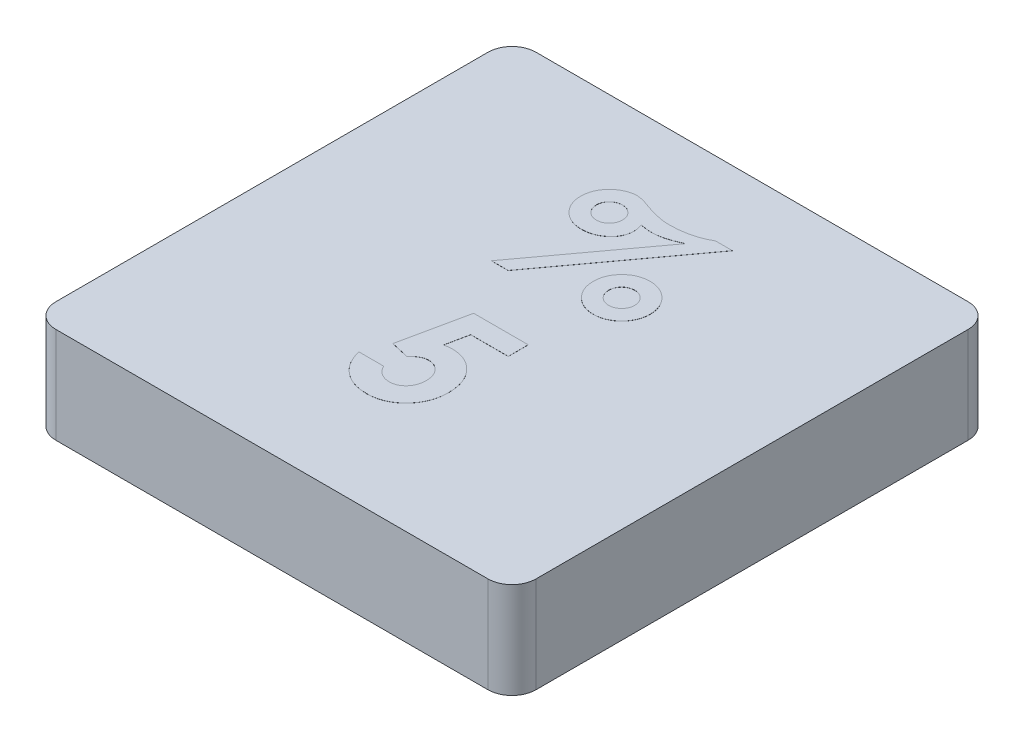
from build123d import *

# Parameters (mm, degrees)
SKETCH1_W           = 12.7
SKETCH1_H           = 12.7
BOSS_EXTRUDE1_DEPTH = 2.54
FILLET1_R           = 0.635
SHELL1_START        = 0.635
SHELL1_OUTLINE_W    = 1.905
SHELL1_OUTLINE_H    = 11.43
SHELL1_DEPTH        = 11.43
SKETCH2_R           = 2.54
BOSS_EXTRUDE2_DEPTH = 1.905
BOSS_EXTRUDE4_DEPTH = 0.00254


# Read off the part's stored shape, not the designer's step: Shell1
with BuildPart() as part:
    # Sketch1 → Boss-Extrude1 (new body)
    with BuildSketch(Plane(origin=(0, 0, 0), x_dir=(1, 0, 0), z_dir=(0, 1, 0))):
        with Locations((6.35, 6.35)):
            Rectangle(SKETCH1_W, SKETCH1_H)
    extrude(amount=BOSS_EXTRUDE1_DEPTH)

    # Fillet1
    fillet1_edges = [part.edges().sort_by_distance(p)[0] for p in [
        (0, 1.27, -12.7),
        (12.7, 1.27, -12.7),
        (12.7, 1.27, 0),
        (0, 1.27, 0),
    ]]
    fillet(fillet1_edges, radius=FILLET1_R)

    # Shell1 outline → Shell1 (cut)
    with BuildSketch(Plane.YZ.offset(SHELL1_START)):
        with Locations((0.9525, -6.35)):
            Rectangle(SHELL1_OUTLINE_W, SHELL1_OUTLINE_H)
    extrude(amount=SHELL1_DEPTH, mode=Mode.SUBTRACT)

    # Sketch2 → Boss-Extrude2 (add)
    with BuildSketch(Plane(origin=(0, 1.905, 0), x_dir=(-1, 0, 0), z_dir=(0, -1, 0))):
        with Locations(Location((-6.35, 6.35, 0), (0, 0, 270))):
            Circle(SKETCH2_R)
    extrude(amount=BOSS_EXTRUDE2_DEPTH)

    # Sketch4 → Boss-Extrude4 (add)
    # profile 1 of 3: a face of its own
    with BuildSketch(Plane(origin=(0, 2.54, 0), x_dir=(1, 0, 0), z_dir=(0, 1, 0))):
        with BuildLine():
            Line((5.791703726, 5.8928), (7.237371795, 5.8928))
            Line((7.237371795, 5.8928), (7.237371795, 5.363633333))
            Line((7.237371795, 5.363633333), (6.243276242, 5.363633333))
            Line((6.243276242, 5.363633333), (6.119252804, 4.763232692))
            add(Edge.make_bspline(
                [(6.119252804, 4.763232692), (6.136152773, 4.767939547), (6.169482984, 4.777222431), (6.219694987, 4.78653199), (6.268357416, 4.79256615), (6.300289405, 4.793371026), (6.315782252, 4.793761538)],
                knots=[0, 0, 0, 0, 1.05461699, 2.079921384, 3.068411212, 4, 4, 4, 4], degree=3))
            add(Edge.make_bspline(
                [(6.315782252, 4.793761538), (6.349542787, 4.792987935), (6.416092238, 4.791462993), (6.513445641, 4.776986318), (6.606667276, 4.754185994), (6.695471873, 4.721668028), (6.779772683, 4.679345055), (6.859671896, 4.628146122), (6.935267573, 4.567981304), (7.005216817, 4.498812934), (7.069489105, 4.422864498), (7.125370193, 4.340718228), (7.17309613, 4.25354545), (7.21105569, 4.1608043), (7.241016611, 4.063077254), (7.262667041, 3.960301687), (7.275470022, 3.852355795), (7.277196426, 3.77871203), (7.278076923, 3.741152364)],
                knots=[0, 0, 0, 0, 1.01440847, 1.999622559, 2.951875003, 3.895578053, 4.836219714, 5.782137149, 6.743708247, 7.735272588, 8.734977101, 9.730283169, 10.717124674, 11.717316708, 12.737475749, 13.78628267, 14.87096371, 16, 16, 16, 16], degree=3))
            add(Edge.make_bspline(
                [(7.278076923, 3.741152364), (7.277000941, 3.703166309), (7.274877714, 3.628208718), (7.261025605, 3.517994546), (7.236576383, 3.41243425), (7.202992931, 3.311245249), (7.158748882, 3.215171256), (7.105539358, 3.123217017), (7.042464729, 3.03606508), (6.970143973, 2.954608856), (6.891521825, 2.880156304), (6.807807797, 2.814660252), (6.719590005, 2.759545854), (6.626866321, 2.715004103), (6.530168729, 2.679763462), (6.429467881, 2.654109958), (6.324274384, 2.639399099), (6.252861667, 2.637403885), (6.216563502, 2.636389744)],
                knots=[0, 0, 0, 0, 1.06808661, 2.107647099, 3.116961351, 4.110378221, 5.100014249, 6.085620622, 7.093190682, 8.119403071, 9.144090782, 10.133780668, 11.103064255, 12.062861538, 13.020824475, 13.992378307, 14.979551724, 16, 16, 16, 16], degree=3))
            add(Edge.make_bspline(
                [(6.216563502, 2.636389744), (6.184103133, 2.637219374), (6.120084493, 2.63885558), (6.025787847, 2.648912563), (5.934875408, 2.666693402), (5.847829824, 2.692426881), (5.763735227, 2.724098918), (5.683563777, 2.763710786), (5.606874917, 2.810508222), (5.533886414, 2.863637171), (5.465784228, 2.923484872), (5.403627769, 2.988998491), (5.347040734, 3.059352263), (5.297233997, 3.135414138), (5.254363686, 3.217071739), (5.21634542, 3.303362714), (5.185227088, 3.395188215), (5.169435431, 3.458846753), (5.161410256, 3.491197436)],
                knots=[0, 0, 0, 0, 1.054957082, 2.080596141, 3.077793124, 4.061112343, 5.027190972, 5.994718051, 6.962465889, 7.943658696, 8.924948258, 9.904494768, 10.875059, 11.855380583, 12.854004648, 13.869083016, 14.917087635, 16, 16, 16, 16], degree=3))
            Line((5.161410256, 3.491197436), (5.812692308, 3.491197436))
            add(Edge.make_bspline(
                [(5.812692308, 3.491197436), (5.824597759, 3.46877973), (5.847734646, 3.425213478), (5.891746119, 3.367372731), (5.941014169, 3.318048628), (5.995094372, 3.27675926), (6.054337133, 3.245825968), (6.116328422, 3.222367591), (6.181847008, 3.208811863), (6.226468059, 3.207117263), (6.249000401, 3.206261538)],
                knots=[0, 0, 0, 0, 1.104910296, 2.147267069, 3.153527244, 4.136738762, 5.099945312, 6.05603338, 7.018353, 8, 8, 8, 8], degree=3))
            add(Edge.make_bspline(
                [(6.249000401, 3.206261538), (6.264705141, 3.206852424), (6.295604481, 3.208015), (6.341129773, 3.21416532), (6.384585664, 3.225813887), (6.426295239, 3.241944445), (6.46637054, 3.262061072), (6.504237073, 3.287457003), (6.540553649, 3.316688661), (6.574767381, 3.350232088), (6.605755161, 3.387625207), (6.632928054, 3.427806662), (6.657224368, 3.469883613), (6.675221019, 3.515522833), (6.689958754, 3.563361519), (6.700812218, 3.613760534), (6.707298387, 3.666778738), (6.707898833, 3.70297278), (6.708205128, 3.721435817)],
                knots=[0, 0, 0, 0, 0.978869489, 1.925942215, 2.855067702, 3.774946051, 4.70828698, 5.642468714, 6.60995405, 7.609372294, 8.622401667, 9.629904756, 10.629323, 11.642352373, 12.678539694, 13.745912462, 14.850161547, 16, 16, 16, 16], degree=3))
            add(Edge.make_bspline(
                [(6.708205128, 3.721435817), (6.707849637, 3.739470285), (6.707157666, 3.774574815), (6.701433541, 3.826120838), (6.691193193, 3.875028686), (6.677240629, 3.921672956), (6.659379682, 3.965770401), (6.637552412, 4.00758351), (6.611665568, 4.046900934), (6.581580172, 4.082922208), (6.549497414, 4.115961945), (6.515030223, 4.144858236), (6.478489131, 4.168840151), (6.441009605, 4.18977706), (6.4010956, 4.205014487), (6.359644619, 4.21550794), (6.316700255, 4.223207614), (6.287408836, 4.223659998), (6.272533053, 4.223889744)],
                knots=[0, 0, 0, 0, 1.166249705, 2.270133367, 3.348514167, 4.393962215, 5.415026464, 6.420877785, 7.440098956, 8.453121383, 9.451844239, 10.415694839, 11.355045125, 12.27538808, 13.187007209, 14.108269027, 15.039275622, 16, 16, 16, 16], degree=3))
            add(Edge.make_bspline(
                [(6.272533053, 4.223889744), (6.256374495, 4.223276616), (6.223989278, 4.222047777), (6.175872951, 4.212049042), (6.128336774, 4.195867337), (6.081116395, 4.173542112), (6.03468056, 4.144325435), (5.987803803, 4.110057624), (5.942055191, 4.068248796), (5.912966951, 4.037109485), (5.89791867, 4.02100012)],
                knots=[0, 0, 0, 0, 0.88288272, 1.769486374, 2.674910571, 3.623812639, 4.617874466, 5.670434592, 6.794841017, 8, 8, 8, 8], degree=3))
            Line((5.89791867, 4.02100012), (5.418361378, 4.13103117))
            Line((5.418361378, 4.13103117), (5.791703726, 5.8928))
        make_face()
    # profile 2 of 3: a face of its own
    with BuildSketch(Plane(origin=(0, 2.54, 0), x_dir=(1, 0, 0), z_dir=(0, 1, 0))):
        with BuildLine():
            Line((7.334428085, 10.749410256), (7.782184495, 10.749410256))
            Line((7.782184495, 10.749410256), (5.269278846, 7.330179487))
            Line((5.269278846, 7.330179487), (4.824702524, 7.330179487))
            Line((4.824702524, 7.330179487), (7.003698918, 10.294021635))
            add(Edge.make_bspline(
                [(7.003698918, 10.294021635), (6.971161062, 10.278515475), (6.907660287, 10.248253706), (6.812751511, 10.207957695), (6.720631579, 10.174162457), (6.631393144, 10.146830824), (6.54571733, 10.124937871), (6.463103714, 10.109434187), (6.383789665, 10.100280365), (6.331873811, 10.098832433), (6.306623598, 10.098128205)],
                knots=[0, 0, 0, 0, 1.184746767, 2.312147913, 3.388055768, 4.408713513, 5.378921178, 6.293361464, 7.169945538, 8, 8, 8, 8], degree=3))
            add(Edge.make_bspline(
                [(6.306623598, 10.098128205), (6.280737611, 10.098372121), (6.228234645, 10.09886684), (6.148559388, 10.107001685), (6.066431878, 10.116206097), (6.011451424, 10.12699396), (5.983526643, 10.132473157)],
                knots=[0, 0, 0, 0, 0.954023388, 1.934987345, 2.951172226, 4, 4, 4, 4], degree=3))
            add(Edge.make_bspline(
                [(5.983526643, 10.132473157), (5.99109623, 10.111386352), (6.005688067, 10.070737478), (6.021027763, 10.009865212), (6.030332826, 9.951920468), (6.0317938, 9.914137817), (6.0325, 9.895874599)],
                knots=[0, 0, 0, 0, 1.106503302, 2.132997967, 3.097536435, 4, 4, 4, 4], degree=3))
            add(Edge.make_bspline(
                [(6.0325, 9.895874599), (6.031956025, 9.873573311), (6.030882872, 9.829577387), (6.020337876, 9.764925729), (6.003236685, 9.702776771), (5.978685451, 9.643442241), (5.948286499, 9.586401194), (5.910007257, 9.532570281), (5.865391699, 9.481153099), (5.814897755, 9.432392522), (5.759252659, 9.388522857), (5.70057033, 9.348934639), (5.63809611, 9.317049236), (5.573190212, 9.289737291), (5.50523594, 9.268823251), (5.434072532, 9.254352123), (5.360043175, 9.245192774), (5.309587108, 9.243952007), (5.283907252, 9.243320513)],
                knots=[0, 0, 0, 0, 0.968638251, 1.910927052, 2.838731862, 3.764475236, 4.696252554, 5.642138921, 6.628626751, 7.651788751, 8.687938962, 9.705108259, 10.723111985, 11.731056968, 12.762854794, 13.807411544, 14.884071636, 16, 16, 16, 16], degree=3))
            add(Edge.make_bspline(
                [(5.283907252, 9.243320513), (5.258008022, 9.243862785), (5.207060861, 9.244929505), (5.132269572, 9.255401399), (5.060451245, 9.272576486), (4.991704378, 9.296883819), (4.925590685, 9.327610203), (4.862416389, 9.365209956), (4.802618612, 9.410084763), (4.746236132, 9.460574683), (4.695139831, 9.516337064), (4.649695061, 9.57519437), (4.611968557, 9.637691665), (4.580493072, 9.702717457), (4.55628548, 9.771004191), (4.539399603, 9.842031204), (4.527790963, 9.915634919), (4.526875468, 9.965790495), (4.526410256, 9.991277244)],
                knots=[0, 0, 0, 0, 1.048605301, 2.062743289, 3.052144275, 4.035376283, 5.011267406, 6.001003776, 7.007513402, 8.035232587, 9.062377508, 10.067200388, 11.042222018, 12.014023559, 12.989158645, 13.970212949, 14.968555884, 16, 16, 16, 16], degree=3))
            add(Edge.make_bspline(
                [(4.526410256, 9.991277244), (4.52765132, 10.024227354), (4.530113116, 10.089587755), (4.549275376, 10.185577129), (4.579731474, 10.278142828), (4.623416785, 10.365689911), (4.677314307, 10.448164002), (4.74227953, 10.522510378), (4.81742886, 10.588459061), (4.901004219, 10.64460362), (4.989322093, 10.690719992), (5.079082843, 10.723922823), (5.168151383, 10.745934816), (5.227815974, 10.748263583), (5.257194511, 10.749410256)],
                knots=[0, 0, 0, 0, 1.019835865, 2.022963857, 3.019602811, 4.029733115, 5.044079856, 6.06323913, 7.077458357, 8.131878931, 9.174395684, 10.1549869, 11.091525037, 12, 12, 12, 12], degree=3))
            add(Edge.make_bspline(
                [(5.257194511, 10.749410256), (5.281427691, 10.748048294), (5.334794778, 10.745048936), (5.420566757, 10.727143649), (5.518777759, 10.698758058), (5.587434921, 10.673750526), (5.624176683, 10.660367788)],
                knots=[0, 0, 0, 0, 0.766991245, 1.689092761, 2.763321979, 4, 4, 4, 4], degree=3))
            add(Edge.make_bspline(
                [(5.624176683, 10.660367788), (5.658027445, 10.64808356), (5.72433688, 10.624020282), (5.823071172, 10.592006574), (5.91879366, 10.565360439), (6.011543909, 10.543637127), (6.1010266, 10.52624847), (6.18763626, 10.514107891), (6.271095481, 10.506897059), (6.325691168, 10.505743955), (6.352416867, 10.505179487)],
                knots=[0, 0, 0, 0, 1.154668847, 2.261852749, 3.327345382, 4.339816463, 5.315774316, 6.249304505, 7.142998968, 8, 8, 8, 8], degree=3))
            add(Edge.make_bspline(
                [(6.352416867, 10.505179487), (6.399295126, 10.505877372), (6.491287751, 10.507246882), (6.626785638, 10.519071014), (6.757044939, 10.537823766), (6.882395572, 10.564676874), (7.002906485, 10.599023648), (7.118610995, 10.640866283), (7.229516084, 10.690443736), (7.299515532, 10.729787413), (7.334428085, 10.749410256)],
                knots=[0, 0, 0, 0, 1.098379891, 2.155430926, 3.184762878, 4.180638884, 5.157205786, 6.119039716, 7.061862248, 8, 8, 8, 8], degree=3))
        make_face()
        with BuildLine():
            add(Edge.make_bspline(
                [(5.279455128, 10.342358974), (5.256422971, 10.341177748), (5.211017096, 10.338849064), (5.14572988, 10.319073448), (5.085890771, 10.286460972), (5.033228397, 10.241971378), (4.988797404, 10.189567563), (4.956872514, 10.129944654), (4.936932914, 10.065470351), (4.934629763, 10.020465291), (4.933461538, 9.99763742)],
                knots=[0, 0, 0, 0, 1.017893676, 2.006687987, 2.989361888, 4.015528455, 5.041695023, 6.011649149, 6.991450778, 8, 8, 8, 8], degree=3))
            add(Edge.make_bspline(
                [(4.933461538, 9.99763742), (4.93457434, 9.974370673), (4.936748554, 9.928911622), (4.957196791, 9.863808766), (4.988372228, 9.80335595), (5.033277943, 9.750785169), (5.085878128, 9.706263219), (5.14573321, 9.673659054), (5.211016233, 9.653881256), (5.256422681, 9.65155287), (5.279455128, 9.650371795)],
                knots=[0, 0, 0, 0, 1.022731703, 1.998234309, 2.980426153, 4.002090265, 5.023754376, 6.00211665, 6.986572482, 8, 8, 8, 8], degree=3))
            add(Edge.make_bspline(
                [(5.279455128, 9.650371795), (5.30248212, 9.651562553), (5.347877811, 9.653910028), (5.413059514, 9.67349398), (5.472475937, 9.70648347), (5.525062909, 9.750731496), (5.569768898, 9.80354296), (5.601856618, 9.863619215), (5.622116144, 9.928936248), (5.624320493, 9.97437901), (5.625448718, 9.99763742)],
                knots=[0, 0, 0, 0, 1.013910294, 1.9988351, 2.969460266, 3.991611077, 5.013761889, 6.000813773, 6.976781088, 8, 8, 8, 8], degree=3))
            add(Edge.make_bspline(
                [(5.625448718, 9.99763742), (5.624313053, 10.020892095), (5.622094168, 10.06632756), (5.601995698, 10.131517565), (5.569720669, 10.191104074), (5.525066492, 10.243355628), (5.472257236, 10.286785183), (5.413195307, 10.320081716), (5.347753145, 10.338614358), (5.302460177, 10.341097663), (5.279455128, 10.342358974)],
                knots=[0, 0, 0, 0, 1.02629359, 2.005193596, 2.986963232, 4.00500024, 5.0242455, 5.997787305, 6.983042999, 8, 8, 8, 8], degree=3))
        make_face(mode=Mode.SUBTRACT)
    # profile 3 of 3: a face of its own
    with BuildSketch(Plane(origin=(0, 2.54, 0), x_dir=(1, 0, 0), z_dir=(0, 1, 0))):
        with BuildLine():
            add(Edge.make_bspline(
                [(7.396121795, 8.958384615), (7.421606582, 8.957905742), (7.471968223, 8.956959419), (7.545804623, 8.945472081), (7.61702507, 8.928494567), (7.685335729, 8.904333139), (7.750440065, 8.872636413), (7.813402385, 8.835325021), (7.87240698, 8.789479647), (7.928669708, 8.738355244), (7.980594122, 8.682630827), (8.025064592, 8.622254458), (8.063609595, 8.559911697), (8.095039935, 8.494509681), (8.11940874, 8.42607046), (8.136158131, 8.354573264), (8.147790244, 8.280344602), (8.148702927, 8.229766676), (8.149166667, 8.204067708)],
                knots=[0, 0, 0, 0, 1.031266021, 2.037931485, 3.018816395, 3.993783109, 4.965416853, 5.947616245, 6.952265628, 7.98556715, 9.024667486, 10.031003323, 11.017658855, 11.989292599, 12.964259313, 13.953489464, 14.960154928, 16, 16, 16, 16], degree=3))
            add(Edge.make_bspline(
                [(8.149166667, 8.204067708), (8.148701621, 8.178580847), (8.147786453, 8.128425051), (8.136175437, 8.054822941), (8.11929836, 7.983789983), (8.095058221, 7.915525234), (8.06357715, 7.850154631), (8.025267825, 7.787848833), (7.98036631, 7.728007681), (7.92870002, 7.672301641), (7.872399121, 7.6212057), (7.813404415, 7.575352953), (7.750439533, 7.538043471), (7.685335871, 7.506346242), (7.617025032, 7.482184949), (7.545804634, 7.465207398), (7.47196822, 7.45372007), (7.421606581, 7.452773746), (7.396121795, 7.452294872)],
                knots=[0, 0, 0, 0, 1.03335163, 2.033540864, 3.016409493, 3.993347958, 4.966946712, 5.955597634, 6.957081229, 7.998283019, 9.033674266, 10.040355429, 11.024541199, 11.998139953, 12.975078418, 13.957947048, 14.96664837, 16, 16, 16, 16], degree=3))
            add(Edge.make_bspline(
                [(7.396121795, 7.452294872), (7.370424073, 7.452763664), (7.319848597, 7.453686289), (7.24580621, 7.465214293), (7.174570387, 7.482159243), (7.106136197, 7.506505942), (7.040657949, 7.537861485), (6.977570015, 7.575368829), (6.918601972, 7.62122953), (6.862252684, 7.672089959), (6.811258545, 7.728223521), (6.766362516, 7.787846143), (6.727890386, 7.849991081), (6.697340286, 7.915698525), (6.672895101, 7.983766381), (6.656081804, 8.054829368), (6.644453566, 8.12842337), (6.643540766, 8.178580281), (6.643076923, 8.204067708)],
                knots=[0, 0, 0, 0, 1.041501899, 2.049771325, 3.032219118, 4.008739287, 4.989680258, 5.973444628, 6.979694759, 8.014642682, 9.049590606, 10.050645394, 11.038873005, 12.008361878, 12.984882046, 13.96732984, 14.967090821, 16, 16, 16, 16], degree=3))
            add(Edge.make_bspline(
                [(6.643076923, 8.204067708), (6.643539445, 8.229767249), (6.64444973, 8.280346304), (6.656099285, 8.354566755), (6.672784258, 8.426094279), (6.697358451, 8.494336439), (6.727858111, 8.560075137), (6.766566152, 8.622256972), (6.811032329, 8.68241363), (6.862283031, 8.738566881), (6.918594085, 8.789455843), (6.977572052, 8.835309139), (7.040657411, 8.872818404), (7.10613634, 8.904173438), (7.174570349, 8.928520273), (7.245806221, 8.945465187), (7.319848594, 8.9569932), (7.370424072, 8.957915824), (7.396121795, 8.958384615)],
                knots=[0, 0, 0, 0, 1.039400738, 2.045636048, 3.034443493, 4.008993597, 4.976526591, 5.962760518, 6.96866634, 8.001526325, 9.03438631, 10.038606398, 11.02038609, 11.999348078, 12.973898182, 13.954363952, 14.960599262, 16, 16, 16, 16], degree=3))
        make_face()
        with BuildLine():
            add(Edge.make_bspline(
                [(7.39739383, 8.551333333), (7.373932898, 8.550188027), (7.32809267, 8.547950216), (7.262397932, 8.528046168), (7.202551128, 8.49543889), (7.149920093, 8.450932563), (7.105250932, 8.398446402), (7.073701979, 8.338406814), (7.053507282, 8.273619199), (7.051268792, 8.228387058), (7.050128205, 8.205339744)],
                knots=[0, 0, 0, 0, 1.031901393, 2.016228251, 2.994462349, 4.015992611, 5.037522873, 6.011330449, 6.986705252, 8, 8, 8, 8], degree=3))
            add(Edge.make_bspline(
                [(7.050128205, 8.205339744), (7.051268792, 8.18229243), (7.053507282, 8.137060288), (7.073701979, 8.072272673), (7.105250932, 8.012233085), (7.149920093, 7.959746924), (7.202551128, 7.915240597), (7.262397932, 7.88263332), (7.32809267, 7.862729271), (7.373932898, 7.860491461), (7.39739383, 7.859346154)],
                knots=[0, 0, 0, 0, 1.013294748, 1.988669551, 2.962477127, 3.984007389, 5.005537651, 5.983771749, 6.968098607, 8, 8, 8, 8], degree=3))
            add(Edge.make_bspline(
                [(7.39739383, 7.859346154), (7.420428127, 7.860511283), (7.465634722, 7.86279794), (7.530525627, 7.882616663), (7.589789636, 7.915440252), (7.642336011, 7.959725292), (7.68698948, 8.012238578), (7.718542442, 8.072271238), (7.73873609, 8.137060663), (7.740974724, 8.182292556), (7.742115385, 8.205339744)],
                knots=[0, 0, 0, 0, 1.017844116, 1.99759804, 2.971989089, 3.998105694, 5.0242223, 6.00240196, 6.982155884, 8, 8, 8, 8], degree=3))
            add(Edge.make_bspline(
                [(7.742115385, 8.205339744), (7.740974724, 8.228386931), (7.73873609, 8.273618824), (7.718542442, 8.33840825), (7.68698948, 8.39844091), (7.642336011, 8.450954195), (7.589789636, 8.495239235), (7.530525627, 8.528062824), (7.465634722, 8.547881547), (7.420428127, 8.550168204), (7.39739383, 8.551333333)],
                knots=[0, 0, 0, 0, 1.017844116, 1.99759804, 2.9757777, 4.001894306, 5.028010911, 6.00240196, 6.982155884, 8, 8, 8, 8], degree=3))
        make_face(mode=Mode.SUBTRACT)
    extrude(amount=BOSS_EXTRUDE4_DEPTH)


solid = part.part
